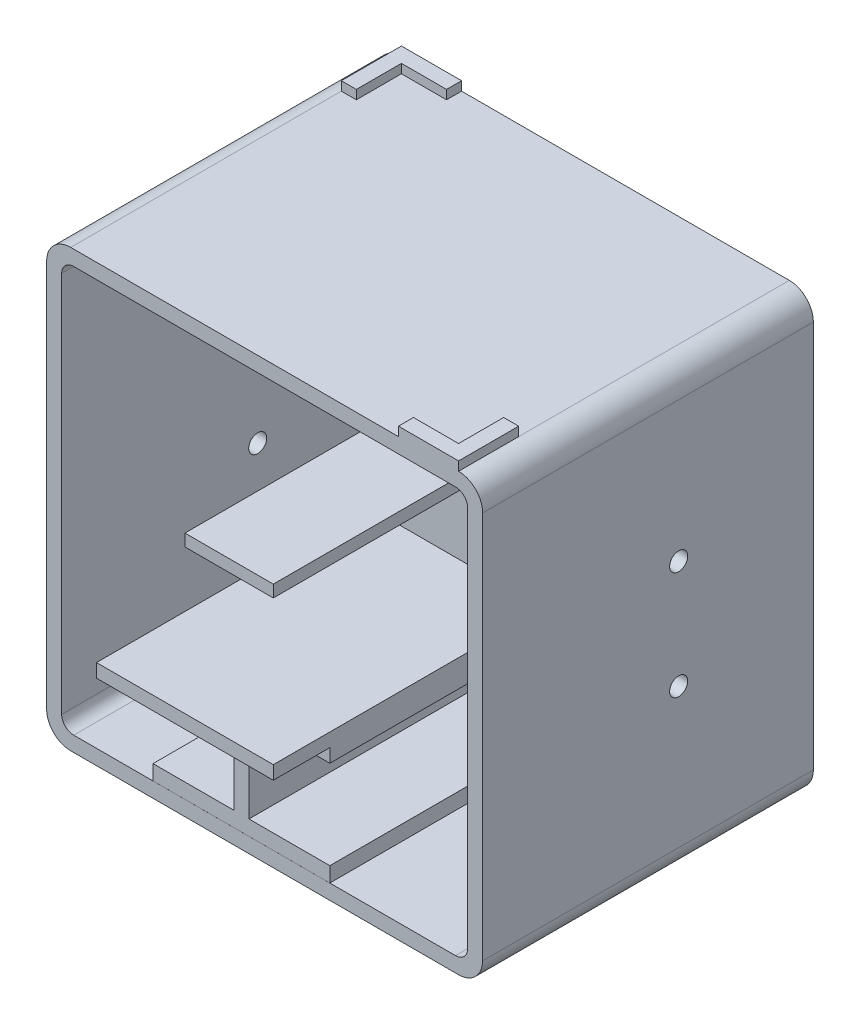
from build123d import *

# Parameters (mm, degrees)
BOSS_EXTRUDE1_DEPTH       = 55
SKETCH2_W                 = 67.5
SKETCH2_H                 = 67.5
BOSS_EXTRUDE2_DEPTH       = 2.5
CUT_EXTRUDE1_REACH        = 75.378
SKETCH3_W                 = 16.5
SKETCH3_H                 = 7
SKETCH3_W_2               = 8
SKETCH3_H_2               = 16
FILLET1_R                 = 1
CUT_EXTRUDE2_REACH        = 77.187
SKETCH4_R                 = 1.5
MIRROR2_COPY_1_REACH      = 77.187
MIRROR2_COPY_1_SKETCH_R   = 1.5
MIRROR2_COPY_2_REACH      = 77.187
MIRROR2_COPY_2_SKETCH_R   = 1.5
BOSS_EXTRUDE3_DEPTH       = 10.84
BOSS_EXTRUDE3_DEPTH_BACK  = 18.56
BOSS_EXTRUDE4_DEPTH       = 47
SKETCH7_W                 = 29.4
SKETCH7_H                 = 19.5
CUT_EXTRUDE3_DEPTH        = 9.4
SKETCH8_R                 = 1.8
BOSS_EXTRUDE5_DEPTH       = 3
SKETCH9_R                 = 2
SKETCH9_R_2               = 1
BOSS_EXTRUDE6_DEPTH       = 1.5
MIRROR4_COPY_1_SKETCH_R   = 1.8
MIRROR4_COPY_1_DEPTH      = 3
MIRROR4_COPY_2_SKETCH_R   = 2
MIRROR4_COPY_2_SKETCH_R_2 = 1
MIRROR4_COPY_2_DEPTH      = 1.5
MIRROR4_COPY_3_SKETCH_R   = 1.8
MIRROR4_COPY_3_DEPTH      = 3
MIRROR4_COPY_4_SKETCH_R   = 2
MIRROR4_COPY_4_SKETCH_R_2 = 1
MIRROR4_COPY_4_DEPTH      = 1.5
SKETCH10_R                = 1.5
CUT_EXTRUDE4_DEPTH        = 104.524153037
CUT_EXTRUDE5_DEPTH        = 2
BOSS_EXTRUDE7_DEPTH       = 1.5


with BuildPart() as part:
    # Sketch1 → Boss-Extrude1 (new body)
    with BuildSketch(Plane.XY):
        with BuildLine():
            Line((-36.25, 32.25), (-36.25, -32.25))
            ThreePointArc((-36.25, -32.25), (-35.078427125, -35.078427125), (-32.25, -36.25))
            Line((-32.25, -36.25), (32.25, -36.25))
            ThreePointArc((32.25, -36.25), (35.078427125, -35.078427125), (36.25, -32.25))
            Line((36.25, -32.25), (36.25, 32.25))
            ThreePointArc((36.25, 32.25), (35.078427125, 35.078427125), (32.25, 36.25))
            Line((32.25, 36.25), (-32.25, 36.25))
            ThreePointArc((-32.25, 36.25), (-35.078427125, 35.078427125), (-36.25, 32.25))
        make_face()
        with BuildLine():
            Line((-31.75, 33.75), (31.75, 33.75))
            ThreePointArc((31.75, 33.75), (33.164213562, 33.164213562), (33.75, 31.75))
            Line((33.75, 31.75), (33.75, -31.75))
            ThreePointArc((33.75, -31.75), (33.164213562, -33.164213562), (31.75, -33.75))
            Line((31.75, -33.75), (-31.75, -33.75))
            ThreePointArc((-31.75, -33.75), (-33.164213562, -33.164213562), (-33.75, -31.75))
            Line((-33.75, -31.75), (-33.75, 31.75))
            ThreePointArc((-33.75, 31.75), (-33.164213562, 33.164213562), (-31.75, 33.75))
        make_face(mode=Mode.SUBTRACT)
    extrude(amount=BOSS_EXTRUDE1_DEPTH)

    # Sketch2 → Boss-Extrude2 (add)
    with BuildSketch(Plane.XY):
        Rectangle(SKETCH2_W, SKETCH2_H)
    extrude(amount=BOSS_EXTRUDE2_DEPTH)

    # Sketch3 → Cut-Extrude1 (cut, up to next)
    with BuildSketch(Plane.XY.offset(2.5), mode=Mode.PRIVATE) as cut_extrude1_sk1:
        with Locations((-11.63, 14.79)):
            Rectangle(SKETCH3_W, SKETCH3_H)
    cut_extrude1_tool1 = extrude(cut_extrude1_sk1.sketch, amount=-CUT_EXTRUDE1_REACH, mode=Mode.PRIVATE) & part.part
    # Sketch3 → Cut-Extrude1 (cut, up to next)
    with BuildSketch(Plane.XY.offset(2.5), mode=Mode.PRIVATE) as cut_extrude1_sk2:
        Rectangle(SKETCH3_W_2, SKETCH3_H_2)
    cut_extrude1_tool2 = extrude(cut_extrude1_sk2.sketch, amount=-CUT_EXTRUDE1_REACH, mode=Mode.PRIVATE) & part.part
    add(cut_extrude1_tool1.solids().sort_by_distance((-11.63, 14.79, 2.5))[0], mode=Mode.SUBTRACT)
    add(cut_extrude1_tool2.solids().sort_by_distance((0, 0, 2.5))[0], mode=Mode.SUBTRACT)

    # Fillet1
    fillet1_edges = [part.edges().sort_by_distance(p)[0] for p in [
        (-19.88, 11.29, 1.25),
        (-19.88, 18.29, 1.25),
        (-3.38, 18.29, 1.25),
        (-3.38, 11.29, 1.25),
        (4, -8, 1.25),
        (-4, -8, 1.25),
        (-4, 8, 1.25),
        (4, 8, 1.25),
    ]]
    fillet(fillet1_edges, radius=FILLET1_R)

    # Sketch4 → Cut-Extrude2 (cut, up to next)
    with BuildSketch(Plane(origin=(0, 0, 0), x_dir=(-1, 0, 0), z_dir=(0, 0, -1)), mode=Mode.PRIVATE) as cut_extrude2_sk1:
        with Locations((-28.75, 28.75)):
            Circle(SKETCH4_R)
    cut_extrude2_tool1 = extrude(cut_extrude2_sk1.sketch, amount=-CUT_EXTRUDE2_REACH, mode=Mode.PRIVATE) & part.part
    cut_extrude2 = cut_extrude2_tool1.solids().sort_by_distance((28.75, 28.75, 0))[0]
    add(cut_extrude2, mode=Mode.SUBTRACT)

    # Mirror1: Cut-Extrude2 across plane
    add(cut_extrude2.mirror(Plane(origin=(0, 0, 0), x_dir=(0, 0, 1), z_dir=(1, 0, 0))), mode=Mode.SUBTRACT)

    # Mirror2 copy 1 sketch → Mirror2 copy 1 (cut, up to next)
    with BuildSketch(Plane(origin=(0, 0, 0), x_dir=(1, 0, 0), z_dir=(0, 0, -1)), mode=Mode.PRIVATE) as mirror2_copy_1_sk1:
        with Locations((-28.75, 28.75)):
            Circle(MIRROR2_COPY_1_SKETCH_R)
    mirror2_copy_1_tool1 = extrude(mirror2_copy_1_sk1.sketch, amount=-MIRROR2_COPY_1_REACH, mode=Mode.PRIVATE) & part.part
    add(mirror2_copy_1_tool1.solids().sort_by_distance((-28.75, -28.75, 0))[0], mode=Mode.SUBTRACT)

    # Mirror2 copy 2 sketch → Mirror2 copy 2 (cut, up to next)
    with BuildSketch(Plane(origin=(0, 0, 0), x_dir=(-1, 0, 0), z_dir=(0, 0, -1)), mode=Mode.PRIVATE) as mirror2_copy_2_sk1:
        with Locations((-28.75, -28.75)):
            Circle(MIRROR2_COPY_2_SKETCH_R)
    mirror2_copy_2_tool1 = extrude(mirror2_copy_2_sk1.sketch, amount=-MIRROR2_COPY_2_REACH, mode=Mode.PRIVATE) & part.part
    add(mirror2_copy_2_tool1.solids().sort_by_distance((28.75, -28.75, 0))[0], mode=Mode.SUBTRACT)



with BuildPart() as body_2:
    # Sketch5 → Boss-Extrude3 (new, two sides: drawn at the far end of the back side and taken through both)
    with BuildSketch(Plane(origin=(0, 0, 0), x_dir=(0, 0, -1), z_dir=(1, 0, 0)).offset(-BOSS_EXTRUDE3_DEPTH_BACK)):
        Polygon((-17.396721671, 14), (-64.396721671, 14), (-64.396721671, 12), (-62.396721671, 12), (-19.396721671, 12), (-19.396721671, -12), (-62.396721671, -12), (-64.396721671, -12), (-64.396721671, -14), (-17.396721671, -14), align=None)
    extrude(amount=BOSS_EXTRUDE3_DEPTH + BOSS_EXTRUDE3_DEPTH_BACK)


with BuildPart() as part_1:
    add(part.part)

    add(body_2.part)  # Boss-Extrude4 merges body 2
    # Sketch6 → Boss-Extrude4 (add)
    with BuildSketch(Plane.XY.offset(64.396721671)):
        Polygon((-18.56, -14), (10.84, -14), (10.84, -16.5), (-2.61, -16.5), (-2.61, -31.25), (10.84, -31.25), (10.84, -33.75), (-18.56, -33.75), (-18.56, -31.25), (-5.11, -31.25), (-5.11, -16.5), (-18.56, -16.5), align=None)
    extrude(amount=-BOSS_EXTRUDE4_DEPTH)

    # Sketch7 → Cut-Extrude3 (cut)
    with BuildSketch(Plane.XY.offset(64.396721671)):
        with Locations((-3.86, -24)):
            Rectangle(SKETCH7_W, SKETCH7_H)
    extrude(amount=-CUT_EXTRUDE3_DEPTH, mode=Mode.SUBTRACT)

    # Sketch8 → Boss-Extrude5 (add)
    with BuildSketch(Plane.ZY.offset(18.56)):
        with BuildLine():
            Line((19.396721671, 12), (24.896721671, 12))
            Line((24.896721671, 12), (24.896721671, 8.1))
            ThreePointArc((24.896721671, 8.1), (24.428092521, 6.96862915), (23.296721671, 6.5))
            Line((23.296721671, 6.5), (19.396721671, 6.5))
            Line((19.396721671, 6.5), (19.396721671, 12))
        make_face()
        with Locations((22.396721671, 9)):
            Circle(SKETCH8_R, mode=Mode.SUBTRACT)
    boss_extrude5 = extrude(amount=-BOSS_EXTRUDE5_DEPTH)

    # Sketch9 → Boss-Extrude6 (add)
    with BuildSketch(Plane.ZY.offset(15.56)):
        with Locations((22.396721671, 9)):
            Circle(SKETCH9_R)
        with Locations((22.396721671, 9)):
            Circle(SKETCH9_R_2, mode=Mode.SUBTRACT)
    boss_extrude6 = extrude(amount=BOSS_EXTRUDE6_DEPTH)

    # Mirror3: Boss-Extrude5, Boss-Extrude6 across plane
    add(boss_extrude5.mirror(Plane.ZY.offset(3.86)))
    add(boss_extrude6.mirror(Plane.ZY.offset(3.86)))

    # Mirror4 copy 1 sketch → Mirror4 copy 1 (add)
    with BuildSketch(Plane(origin=(10.84, 0, 0), x_dir=(0, 0, 1), z_dir=(1, 0, 0))):
        with BuildLine():
            Line((19.396721671, 12), (24.896721671, 12))
            Line((24.896721671, 12), (24.896721671, 8.1))
            ThreePointArc((24.896721671, 8.1), (24.428092521, 6.96862915), (23.296721671, 6.5))
            Line((23.296721671, 6.5), (19.396721671, 6.5))
            Line((19.396721671, 6.5), (19.396721671, 12))
        make_face()
        with Locations((22.396721671, 9)):
            Circle(MIRROR4_COPY_1_SKETCH_R, mode=Mode.SUBTRACT)
    extrude(amount=-MIRROR4_COPY_1_DEPTH)

    # Mirror4 copy 2 sketch → Mirror4 copy 2 (add)
    with BuildSketch(Plane(origin=(7.84, 0, 0), x_dir=(0, 0, 1), z_dir=(1, 0, 0))):
        with Locations((22.396721671, 9)):
            Circle(MIRROR4_COPY_2_SKETCH_R)
        with Locations((22.396721671, 9)):
            Circle(MIRROR4_COPY_2_SKETCH_R_2, mode=Mode.SUBTRACT)
    extrude(amount=MIRROR4_COPY_2_DEPTH)

    # Mirror4 copy 3 sketch → Mirror4 copy 3 (add)
    with BuildSketch(Plane.ZY.offset(18.56)):
        with BuildLine():
            Line((19.396721671, -12), (24.896721671, -12))
            Line((24.896721671, -12), (24.896721671, -8.1))
            ThreePointArc((24.896721671, -8.1), (24.428092521, -6.96862915), (23.296721671, -6.5))
            Line((23.296721671, -6.5), (19.396721671, -6.5))
            Line((19.396721671, -6.5), (19.396721671, -12))
        make_face()
        with Locations((22.396721671, -9)):
            Circle(MIRROR4_COPY_3_SKETCH_R, mode=Mode.SUBTRACT)
    extrude(amount=-MIRROR4_COPY_3_DEPTH)

    # Mirror4 copy 4 sketch → Mirror4 copy 4 (add)
    with BuildSketch(Plane.ZY.offset(15.56)):
        with Locations((22.396721671, -9)):
            Circle(MIRROR4_COPY_4_SKETCH_R)
        with Locations((22.396721671, -9)):
            Circle(MIRROR4_COPY_4_SKETCH_R_2, mode=Mode.SUBTRACT)
    extrude(amount=MIRROR4_COPY_4_DEPTH)

    # Sketch10 → Cut-Extrude4 (cut, through all)
    with BuildSketch(Plane.ZY.offset(36.25)):
        with Locations((22.396721671, 9)):
            Circle(SKETCH10_R)
        with Locations((22.396721671, -9)):
            Circle(SKETCH10_R)
    extrude(amount=-CUT_EXTRUDE4_DEPTH, mode=Mode.SUBTRACT)

    # Sketch11 → Cut-Extrude5 (cut)
    with BuildSketch(Plane(origin=(0, 14, 0), x_dir=(1, 0, 0), z_dir=(0, 1, 0))):
        Polygon((-18.56, -64.396721671), (-3.86, -64.396721671), (-3.86, -19.396721671), (-15.56, -19.396721671), (-15.56, -24.896721671), (-18.56, -24.896721671), align=None)
    extrude(amount=-CUT_EXTRUDE5_DEPTH, mode=Mode.SUBTRACT)

    # Sketch12 → Boss-Extrude7 (add)
    with BuildSketch(Plane(origin=(0, 36.25, 0), x_dir=(1, 0, 0), z_dir=(0, 1, 0))):
        Polygon((22.25, -55), (32.25, -55), (32.25, -45), (29.75, -45), (29.75, -52.5), (22.25, -52.5), align=None)
        Polygon((-22.25, 0), (-32.25, 0), (-32.25, -10), (-29.75, -10), (-29.75, -2.5), (-22.25, -2.5), align=None)
    extrude(amount=BOSS_EXTRUDE7_DEPTH)


solid = part_1.part
